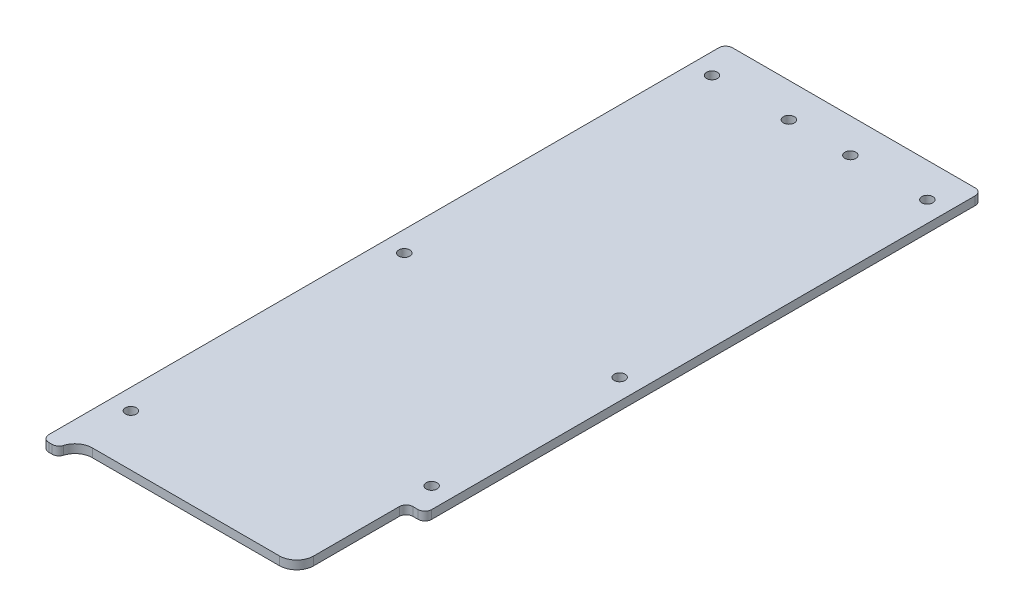
from build123d import *

# Parameters (mm, degrees)
SKETCH1_R           = 2.032
BOSS_EXTRUDE1_DEPTH = 3.175
FILLET1_R           = 2.54
FILLET2_R           = 2.54
FILLET3_R           = 6.35
CUT_EXTRUDE1_DEPTH  = 136.673215063
FILLET4_R           = 6.35
FILLET5_R           = 2.54


with BuildPart() as part:
    # Sketch1 → Boss-Extrude1 (new body)
    with BuildSketch(Plane(origin=(0, 0, 0), x_dir=(1, 0, 0), z_dir=(0, 1, 0))):
        Polygon((47.625, 127), (-47.625, 127), (-47.625, -127), (-41.275, -127), (-41.275, -120.65), (41.275, -120.65), (41.275, -127), (47.625, -127), align=None)
        with Locations((-39.999684148, -101.6)):
            Circle(SKETCH1_R, mode=Mode.SUBTRACT)
        with Locations((39.999684148, -69.85)):
            Circle(SKETCH1_R, mode=Mode.SUBTRACT)
        with Locations((-39.999684148, 0)):
            Circle(SKETCH1_R, mode=Mode.SUBTRACT)
        with Locations((-39.999684148, 114.3)):
            Circle(SKETCH1_R, mode=Mode.SUBTRACT)
        with Locations((-11.424684148, 114.3)):
            Circle(SKETCH1_R, mode=Mode.SUBTRACT)
        with Locations((39.999684148, 0)):
            Circle(SKETCH1_R, mode=Mode.SUBTRACT)
        with Locations((11.424684148, 114.3)):
            Circle(SKETCH1_R, mode=Mode.SUBTRACT)
        with Locations((39.999684148, 114.3)):
            Circle(SKETCH1_R, mode=Mode.SUBTRACT)
    extrude(amount=BOSS_EXTRUDE1_DEPTH)

    # Fillet1
    fillet1_edges = [part.edges().sort_by_distance(p)[0] for p in [
        (-47.625, 1.5875, -127),
        (47.625, 1.5875, -127),
        (47.625, 1.5875, 127),
        (-47.625, 1.5875, 127),
    ]]
    fillet(fillet1_edges, radius=FILLET1_R)

    # Fillet2
    fillet2_edges = [part.edges().sort_by_distance(p)[0] for p in [
        (41.275, 1.5875, 127),
        (-41.275, 1.5875, 127),
    ]]
    fillet(fillet2_edges, radius=FILLET2_R)

    # Fillet3
    fillet3_edges = [part.edges().sort_by_distance(p)[0] for p in [
        (41.275, 1.5875, 120.65),
        (-41.275, 1.5875, 120.65),
    ]]
    fillet(fillet3_edges, radius=FILLET3_R)

    # Sketch2 → Cut-Extrude1 (cut, through all)
    with BuildSketch(Plane.XZ):
        with BuildLine():
            Line((47.625, 131.883089137), (41.91, 131.883089137))
            Line((41.91, 131.883089137), (41.91, 126.140052083))
            ThreePointArc((41.91, 126.140052083), (41.593586007, 125.69163301), (41.380880287, 125.185714286))
            ThreePointArc((41.380880287, 125.185714286), (41.067204187, 124.352196031), (40.64, 123.570760199))
            Line((40.64, 123.570760199), (40.64, 79.981419179))
            Line((40.64, 79.981419179), (47.625, 79.981419179))
            Line((47.625, 79.981419179), (47.625, 131.883089137))
        make_face()
    extrude(amount=-CUT_EXTRUDE1_DEPTH, mode=Mode.SUBTRACT)

    # Fillet4
    fillet4_edges = [part.edges().sort_by_distance(p)[0] for p in [
        (40.64, 1.5875, 123.570760199),
    ]]
    fillet(fillet4_edges, radius=FILLET4_R)

    # Fillet5
    fillet5_edges = [part.edges().sort_by_distance(p)[0] for p in [
        (47.625, 1.5875, 79.981419179),
        (40.64, 1.5875, 79.981419179),
    ]]
    fillet(fillet5_edges, radius=FILLET5_R)


solid = part.part
